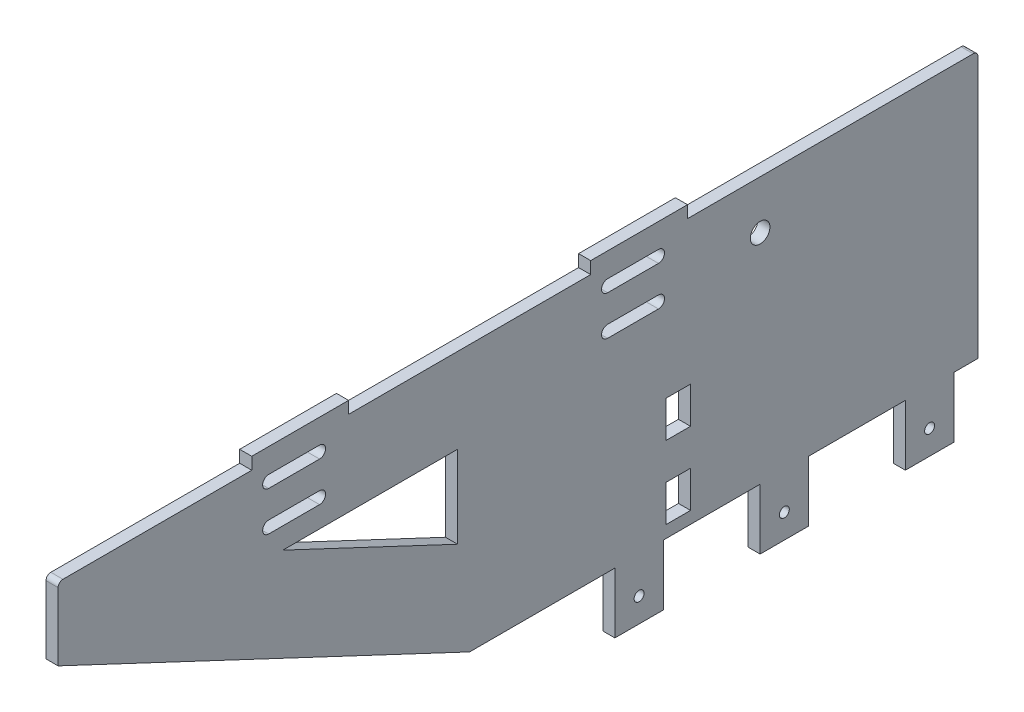
from build123d import *

# Parameters (mm, degrees)
SKETCH_1_W          = 180
SKETCH_1_H          = 110
SKETCH_1_R          = 4.05
EXTRUDE_1_DEPTH     = 5
SKETCH_2_W          = 20
SKETCH_2_H          = 25
SKETCH_2_R          = 2.05
EXTRUDE_2_DEPTH     = 5
EXTRUDE_3_DEPTH     = 5
SKETCH_4_W          = 10.1
SKETCH_4_H          = 15.1
CUT_EXTRUDE_1_DEPTH = 301.873727667
SKETCH_5_W          = 5
SKETCH_5_H          = 40
EXTRUDE_4_DEPTH     = 5
CUT_EXTRUDE_2_DEPTH = 301.873727667
FILLET_1_R          = 2


with BuildPart() as part:
    # 草圖1 → 填料-伸長1 (new body)
    with BuildSketch(Plane(origin=(0, 0, 0), x_dir=(0, 0, -1), z_dir=(1, 0, 0))):
        Rectangle(SKETCH_1_W, SKETCH_1_H)
        with Locations((0, 35)):
            Circle(SKETCH_1_R, mode=Mode.SUBTRACT)
    extrude(amount=EXTRUDE_1_DEPTH)

    # 草圖2 → 填料-伸長2 (add)
    # profile 1 of 3: a face of its own
    with BuildSketch(Plane(origin=(5, 0, 0), x_dir=(0, 0, -1), z_dir=(1, 0, 0))):
        with Locations((-50, -67.5)):
            Rectangle(SKETCH_2_W, SKETCH_2_H)
        with Locations((-50, -70)):
            Circle(SKETCH_2_R, mode=Mode.SUBTRACT)
    # profile 2 of 3: a face of its own
    with BuildSketch(Plane(origin=(5, 0, 0), x_dir=(0, 0, -1), z_dir=(1, 0, 0))):
        with Locations((10, -67.5)):
            Rectangle(SKETCH_2_W, SKETCH_2_H)
        with Locations((10, -70)):
            Circle(SKETCH_2_R, mode=Mode.SUBTRACT)
    # profile 3 of 3: a face of its own
    with BuildSketch(Plane(origin=(5, 0, 0), x_dir=(0, 0, -1), z_dir=(1, 0, 0))):
        with Locations((70, -67.5)):
            Rectangle(SKETCH_2_W, SKETCH_2_H)
        with Locations((70, -70)):
            Circle(SKETCH_2_R, mode=Mode.SUBTRACT)
    extrude(amount=-EXTRUDE_2_DEPTH)

    # 草圖3 → 填料-伸長3 (add)
    with BuildSketch(Plane(origin=(5, 0, 0), x_dir=(0, 0, -1), z_dir=(1, 0, 0))):
        Polygon((-90, 55), (-290, 55), (-290, 25), (-120, -55), (-90, -55), align=None)
        Polygon((-125, 20), (-125, -13.965276589), (-197.176212752, 20), align=None, mode=Mode.SUBTRACT)
    extrude(amount=-EXTRUDE_3_DEPTH)

    # 草圖4 → 除料-伸長1 (cut, through all)
    with BuildSketch(Plane(origin=(5, 0, 0), x_dir=(0, 0, -1), z_dir=(1, 0, 0))):
        with Locations((-33.8, -12.35)):
            Rectangle(SKETCH_4_W, SKETCH_4_H)
        with Locations((-33.8, -42.45)):
            Rectangle(SKETCH_4_W, SKETCH_4_H)
    extrude(amount=-CUT_EXTRUDE_1_DEPTH, mode=Mode.SUBTRACT)

    # 草圖5 → 填料-伸長4 (add)
    with BuildSketch(Plane(origin=(0, 55, 0), x_dir=(1, 0, 0), z_dir=(0, 1, 0))):
        with Locations((2.5, -50)):
            Rectangle(SKETCH_5_W, SKETCH_5_H)
        with Locations((2.5, -190)):
            Rectangle(SKETCH_5_W, SKETCH_5_H)
    extrude(amount=EXTRUDE_4_DEPTH)

    # 草圖6 → 除料-伸長2 (cut, through all)
    with BuildSketch(Plane(origin=(5, 0, 0), x_dir=(0, 0, -1), z_dir=(1, 0, 0))):
        with BuildLine():
            Line((-63, 50), (-42, 50))
            ThreePointArc((-42, 50), (-39.5, 47.5), (-42, 45))
            Line((-42, 45), (-63, 45))
            ThreePointArc((-63, 45), (-65.5, 47.5), (-63, 50))
        make_face()
        with BuildLine():
            Line((-63, 33.7), (-42, 33.7))
            ThreePointArc((-42, 33.7), (-39.5, 31.2), (-42, 28.7))
            Line((-42, 28.7), (-63, 28.7))
            ThreePointArc((-63, 28.7), (-65.5, 31.2), (-63, 33.7))
        make_face()
        with BuildLine():
            Line((-203, 50), (-182, 50))
            ThreePointArc((-182, 50), (-179.5, 47.5), (-182, 45))
            Line((-182, 45), (-203, 45))
            ThreePointArc((-203, 45), (-205.5, 47.5), (-203, 50))
        make_face()
        with BuildLine():
            Line((-203, 33.7), (-182, 33.7))
            ThreePointArc((-182, 33.7), (-179.5, 31.2), (-182, 28.7))
            Line((-182, 28.7), (-203, 28.7))
            ThreePointArc((-203, 28.7), (-205.5, 31.2), (-203, 33.7))
        make_face()
    extrude(amount=-CUT_EXTRUDE_2_DEPTH, mode=Mode.SUBTRACT)

    # 圓角1
    fillet_1_edges = [part.edges().sort_by_distance(p)[0] for p in [
        (2.5, 55, -90),
        (2.5, 55, 290),
    ]]
    fillet(fillet_1_edges, radius=FILLET_1_R)


solid = part.part
